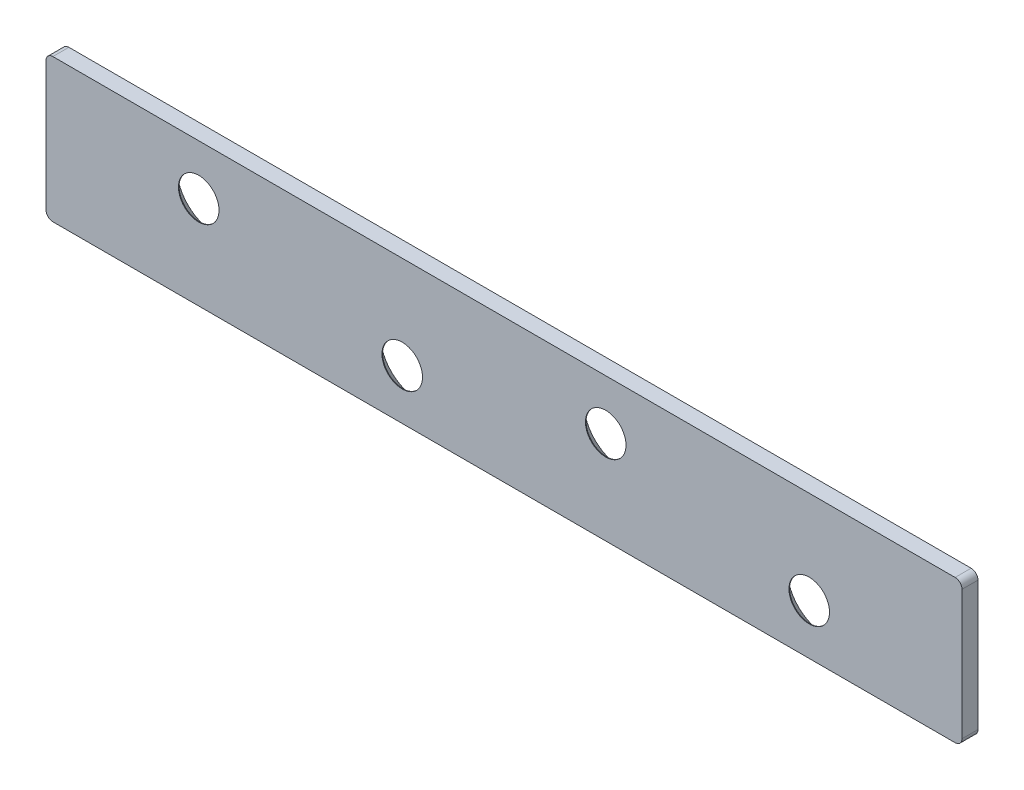
from build123d import *

# Parameters (mm, degrees)
BOSS_EXTRUDE1_DEPTH      = 0.889
BOSS_EXTRUDE1_DEPTH_BACK = 0.889
SKETCH4_W                = 101.6
SKETCH4_H                = 15.875
SKETCH5_R                = 2.2479
CUT_EXTRUDE1_DEPTH       = 52.424062726
SKETCH6_R                = 4.2164
CUT_EXTRUDE2_DEPTH       = 52.447110611
CUT_EXTRUDE2_TAPER       = 49
FILLET1_R                = 0.762


# Read off the part's stored shape, not the designer's step: Sketch-Pattern1
with BuildPart() as part:
    # Sketch4 → Boss-Extrude1 (new, two sides: drawn at the far end of the back side and taken through both)
    with BuildSketch(Plane.XY.offset(-BOSS_EXTRUDE1_DEPTH_BACK)):
        Rectangle(SKETCH4_W, SKETCH4_H)
    extrude(amount=BOSS_EXTRUDE1_DEPTH + BOSS_EXTRUDE1_DEPTH_BACK)

    # Sketch5 → Cut-Extrude1 (cut, symmetric)
    with BuildSketch(Plane.XY):
        with Locations((-33.8582, 2.3749)):
            Circle(SKETCH5_R)
    extrude(amount=CUT_EXTRUDE1_DEPTH, both=True, mode=Mode.SUBTRACT)

    # Sketch6 → Cut-Extrude2 (cut, through all)
    with BuildSketch(Plane.XY.offset(-0.889)):
        with Locations((-33.8582, 2.3749)):
            Circle(SKETCH6_R)
    extrude(amount=CUT_EXTRUDE2_DEPTH, taper=CUT_EXTRUDE2_TAPER, mode=Mode.SUBTRACT)

    # Sketch-Pattern1 outline → Sketch-Pattern1 (revolve, cut)
    with BuildSketch(Plane(origin=(11.286066667, 2.3749, 0), x_dir=(1, 0, 0), z_dir=(0, -1, 0))):
        Polygon((0, -0.889), (4.2164, -0.889), (2.2479, 0.822190943), (2.2479, 0.889), (0, 0.889), align=None)
    revolve(axis=Axis((11.286066667, 2.3749, 0), (0, 0, 1)), mode=Mode.SUBTRACT)

    # Sketch-Pattern1 2 outline → Sketch-Pattern1 2 (revolve, cut)
    with BuildSketch(Plane(origin=(33.8582, -2.3749, 0), x_dir=(1, 0, 0), z_dir=(0, -1, 0))):
        Polygon((0, -0.889), (4.2164, -0.889), (2.2479, 0.822190943), (2.2479, 0.889), (0, 0.889), align=None)
    revolve(axis=Axis((33.8582, -2.3749, 0), (0, 0, 1)), mode=Mode.SUBTRACT)

    # Sketch-Pattern1 3 outline → Sketch-Pattern1 3 (revolve, cut)
    with BuildSketch(Plane(origin=(-11.286066667, -2.3749, 0), x_dir=(1, 0, 0), z_dir=(0, -1, 0))):
        Polygon((0, -0.889), (4.2164, -0.889), (2.2479, 0.822190943), (2.2479, 0.889), (0, 0.889), align=None)
    revolve(axis=Axis((-11.286066667, -2.3749, 0), (0, 0, 1)), mode=Mode.SUBTRACT)

    # Fillet1
    fillet1_edges = [part.edges().sort_by_distance(p)[0] for p in [
        (-50.8, 7.9375, 0),
        (50.8, 7.9375, 0),
        (50.8, -7.9375, 0),
        (-50.8, -7.9375, 0),
    ]]
    fillet(fillet1_edges, radius=FILLET1_R)


solid = part.part
